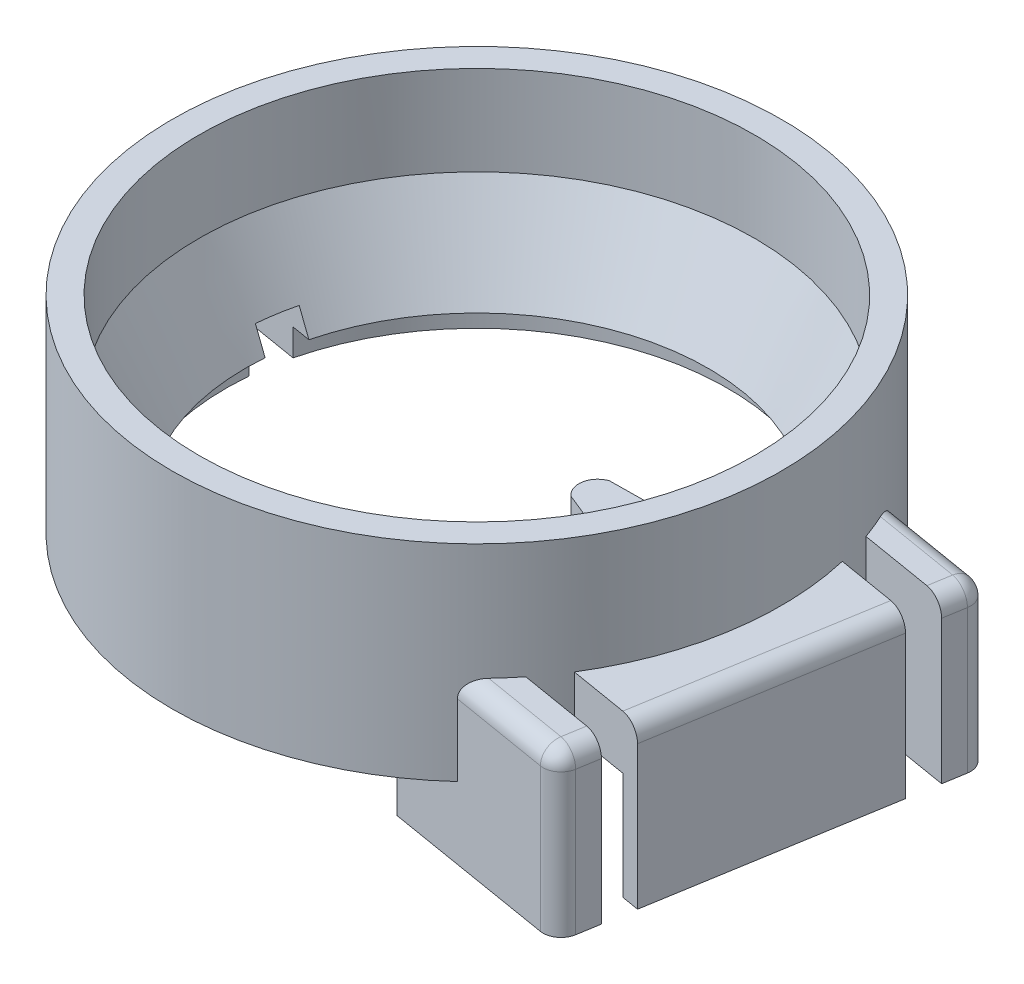
from build123d import *
from build123d.topology import SkipClean

# Parameters (mm, degrees)
CUT_EXTRUDE1_DEPTH      = 12.5
CUT_EXTRUDE1_DEPTH_BACK = 11.5
SKETCH3_W               = 4.25
SKETCH3_H               = 11.109356864
BOSS_EXTRUDE1_REACH     = 69.481
SKETCH4_W               = 6
SKETCH4_H               = 10
CUT_EXTRUDE2_REACH      = 83.113
BOSS_EXTRUDE11_DEPTH    = 14
BOSS_EXTRUDE13_DEPTH    = 18
CUT_EXTRUDE4_START      = -12
CUT_EXTRUDE4_DEPTH      = 12
CUT_EXTRUDE5_DEPTH      = 21
FILLET1_R               = 2
BOSS_EXTRUDE14_DEPTH    = 8
CUT_EXTRUDE6_DEPTH      = 8
BOSS_EXTRUDE15_START    = 10
SKETCH17_R              = 34.003882032
SKETCH17_R_2            = 31.003882032
BOSS_EXTRUDE15_DEPTH    = 10


with BuildPart() as part:
    # Sketch1 → Revolve1 (revolve)
    with BuildSketch(Plane.XY, mode=Mode.PRIVATE) as revolve1_sk:
        Polygon((-28, 3), (-28, 0), (-34.003882032, 0), (-34.003882032, 13), (-31.003882032, 13), (-25.85, 3), align=None)
    revolve(revolve1_sk.sketch.rotate(Axis((0, 20.471698113, 0), (0, -1, 0)), 270), axis=Axis((0, 20.471698113, 0), (0, -1, 0)))

    # Sketch3 → Cut-Extrude1 (cut, two sides: drawn at the far end of the back side and taken through both)
    with BuildSketch(Plane(origin=(-29.494695, 0, -4.906420984), x_dir=(-0.1640943472991815, 0, 0.9864446488194134), z_dir=(-0.9864446488194134, 0, -0.1640943472991815)).offset(-CUT_EXTRUDE1_DEPTH_BACK)):
        Rectangle(SKETCH3_W, SKETCH3_H)
    extrude(amount=CUT_EXTRUDE1_DEPTH + CUT_EXTRUDE1_DEPTH_BACK, mode=Mode.SUBTRACT)

    # Boss-Extrude1: up to this cone (the profile starts inside it)
    boss_extrude1_end = Plane(origin=(0, 8, 0), z_dir=(0, 1, 0)).offset(-55.156366258) * Cone(1e-06, 79.145232917, 153.564307274, align=(Align.CENTER, Align.CENTER, Align.MIN), mode=Mode.PRIVATE)
    # Sketch4 → Boss-Extrude1 (add, up to the surface)
    with BuildSketch(Plane(origin=(20.61669316, 0, 3.429571859), x_dir=(0.16409434729918151, 0, -0.9864446488194133), z_dir=(0.9864446488194133, 0, 0.16409434729918151)), mode=Mode.PRIVATE) as boss_extrude1_sk1:
        with Locations((0, 8)):
            Rectangle(SKETCH4_W, SKETCH4_H)
    boss_extrude1_tool1 = extrude(boss_extrude1_sk1.sketch, amount=BOSS_EXTRUDE1_REACH, mode=Mode.PRIVATE) & boss_extrude1_end
    add(boss_extrude1_tool1.solids().sort_by_distance((20.616693, 8, 3.429572))[0])

    # Sketch8 → Cut-Extrude2 (cut, up to next)
    with BuildSketch(Plane(origin=(35.413362893, 0, 5.890987068), x_dir=(0.16409434729918151, 0, -0.9864446488194133), z_dir=(0.9864446488194133, 0, 0.16409434729918151)), mode=Mode.PRIVATE) as cut_extrude2_sk1:
        Polygon((8, 0), (16.5, 0), (16.5, 4), (16.5, 5), (13, 5), (13, 4), (8, 4), align=None)
    cut_extrude2_tool1 = extrude(cut_extrude2_sk1.sketch, amount=-CUT_EXTRUDE2_REACH, mode=Mode.PRIVATE) & part.part
    # Sketch8 → Cut-Extrude2 (cut, up to next)
    with BuildSketch(Plane(origin=(35.413362893, 0, 5.890987068), x_dir=(0.16409434729918151, 0, -0.9864446488194133), z_dir=(0.9864446488194133, 0, 0.16409434729918151)), mode=Mode.PRIVATE) as cut_extrude2_sk2:
        Polygon((-8, 0), (-16.5, 0), (-16.5, 4), (-16.5, 5), (-13, 5), (-13, 4), (-8, 4), align=None)
    cut_extrude2_tool2 = extrude(cut_extrude2_sk2.sketch, amount=-CUT_EXTRUDE2_REACH, mode=Mode.PRIVATE) & part.part
    add(cut_extrude2_tool1.solids().sort_by_distance((37.461807, 2.233333, -6.42313))[0], mode=Mode.SUBTRACT)
    add(cut_extrude2_tool2.solids().sort_by_distance((33.364918, 2.233333, 18.205104))[0], mode=Mode.SUBTRACT)

    # Sketch7 → Boss-Extrude11 (add)
    with BuildSketch(Plane(origin=(0, 13, 0), x_dir=(-0.16409434729918135, 0, 0.9864446488194134), z_dir=(0, -1, 0))):
        with BuildLine():
            Line((7.14803154, -23.946872012), (7.222129432, -24.19510997))
            ThreePointArc((7.222129432, -24.19510997), (-0.007348449, -25.249998931), (-7.236211102, -24.190902193))
            Line((-7.236211102, -24.190902193), (-7.17062261, -23.971637614))
            ThreePointArc((-7.17062261, -23.971637614), (-5.207034755, -23.520627949), (-3.637045611, -22.258003273))
            Line((-3.637045611, -22.258003273), (-3, -20.9))
            Line((-3, -20.9), (-1.9849332, -15.219532645))
            ThreePointArc((-1.9849332, -15.219532645), (-0.132046904, -14.118560253), (1.720839391, -15.219532645))
            Line((1.720839391, -15.219532645), (3, -20.9))
            Line((3, -20.9), (3.697043222, -22.228205837))
            ThreePointArc((3.697043222, -22.228205837), (5.229163834, -23.475822502), (7.14803154, -23.946872012))
        make_face()
    extrude(amount=BOSS_EXTRUDE11_DEPTH)

    # Sketch11 → Boss-Extrude13 (add)
    with BuildSketch(Plane(origin=(0, 10, 0), x_dir=(1, 0, 0), z_dir=(0, 1, 0))):
        with BuildLine():
            Line((29.827871143, 16.326729506), (42.907596656, 14.150926714))
            Line((42.907596656, 14.150926714), (36.015634069, -27.279748537))
            Line((36.015634069, -27.279748537), (22.935908556, -25.103945745))
            ThreePointArc((22.935908556, -25.103945745), (33.54294747, -5.579844828), (29.827871143, 16.326729506))
        make_face()
    extrude(amount=-BOSS_EXTRUDE13_DEPTH)

    # Sketch12 → Cut-Extrude4 (cut)
    with BuildSketch(Plane.XZ.offset(8).offset(CUT_EXTRUDE4_START)):
        with BuildLine():
            Line((26.62178333, 21.155251016), (34.781169334, 22.512558922))
            Line((34.781169334, 22.512558922), (36.175971286, 14.127779407))
            Line((36.175971286, 14.127779407), (31.288666204, 13.314779774))
            ThreePointArc((31.288666204, 13.314779774), (29.219399183, 17.392259905), (26.62178333, 21.155251016))
        make_face()
        with BuildLine():
            Line((33.914175761, -2.468334607), (38.801480843, -1.655334974))
            Line((38.801480843, -1.655334974), (40.196282795, -10.040114489))
            Line((40.196282795, -10.040114489), (32.036896791, -11.397422395))
            ThreePointArc((32.036896791, -11.397422395), (33.276390202, -6.996130958), (33.914175761, -2.468334607))
        make_face()
    extrude(amount=CUT_EXTRUDE4_DEPTH, mode=Mode.SUBTRACT)

    # Sketch14 → Cut-Extrude5 (cut)
    with SkipClean():  # the faces are left unmerged after this step: merging them gives an invalid solid
        with BuildSketch(Plane(origin=(0, 13, 0), x_dir=(1, 0, 0), z_dir=(0, 1, 0))):
            with BuildLine():
                Line((42.169172093, 9.711925794), (41.594841877, 6.259369523))
                Line((41.594841877, 6.259369523), (33.128064477, 7.667811764))
                ThreePointArc((33.128064477, 7.667811764), (32.635801555, 9.548217117), (32.036896791, 11.397422395))
                Line((32.036896791, 11.397422395), (42.169172093, 9.711925794))
            make_face()
            with BuildLine():
                Line((36.754058632, -22.840747617), (37.328388848, -19.388191346))
                Line((37.328388848, -19.388191346), (28.861611447, -17.979749106))
                ThreePointArc((28.861611447, -17.979749106), (27.787096414, -19.59952209), (26.62178333, -21.155251016))
                Line((26.62178333, -21.155251016), (36.754058632, -22.840747617))
            make_face()
        extrude(amount=-CUT_EXTRUDE5_DEPTH, mode=Mode.SUBTRACT)
    add(part.part.scale(1), mode=Mode.REPLACE)  # the faces are merged on a copy

    # Fillet1
    fillet1_edges = [part.edges().sort_by_distance(p)[0] for p in [
        (29.475771313, 10, 26.191847141),
        (36.384846351, 10, 25.060248077),
        (36.367733899, 10, -15.23882811),
        (36.015634069, 1, 27.279748537),
        (42.907596656, 1, -14.150926714),
        (42.538384374, 10, -11.931426254),
        (39.461615362, 10, 6.564410911),
    ]]
    fillet(fillet1_edges, radius=FILLET1_R)

    # Sketch15 → Boss-Extrude14 (add)
    with BuildSketch(Plane.XZ):
        with BuildLine():
            Line((32.036896791, -11.397422395), (25.022801091, -12.564212095))
            ThreePointArc((25.022801091, -12.564212095), (23.508366053, -15.210415035), (21.715191854, -17.676267784))
            Line((21.715191854, -17.676267784), (29.827871143, -16.326729506))
            ThreePointArc((29.827871143, -16.326729506), (31.030418866, -13.906009429), (32.036896791, -11.397422395))
        make_face()
        with BuildLine():
            Line((26.62178333, 21.155251016), (19.60768763, 19.988461316))
            ThreePointArc((19.60768763, 19.988461316), (17.318129148, 22.001872711), (14.823229267, 23.754407467))
            Line((14.823229267, 23.754407467), (22.935908556, 25.103945745))
            ThreePointArc((22.935908556, 25.103945745), (24.857378257, 23.202903686), (26.62178333, 21.155251016))
        make_face()
    extrude(amount=BOSS_EXTRUDE14_DEPTH)

    # Sketch16 → Cut-Extrude6 (cut)
    with BuildSketch(Plane.XZ.offset(8)):
        Polygon((33.914175761, -2.468334607), (31.288666204, 13.314779774), (35.234444799, 13.971157163), (37.859954356, -1.811957218), align=None)
    extrude(amount=-CUT_EXTRUDE6_DEPTH, mode=Mode.SUBTRACT)

    # Sketch17 → Boss-Extrude15 (add)
    with BuildSketch(Plane(origin=(0, 13, 0), x_dir=(1, 0, 0), z_dir=(0, 1, 0)).offset(BOSS_EXTRUDE15_START)):
        with Locations(Location((0, 0, 0), (0, 0, 270))):
            Circle(SKETCH17_R)
        with Locations(Location((0, 0, 0), (0, 0, 356.108119345))):
            Circle(SKETCH17_R_2, mode=Mode.SUBTRACT)
    extrude(amount=-BOSS_EXTRUDE15_DEPTH)


solid = part.part
